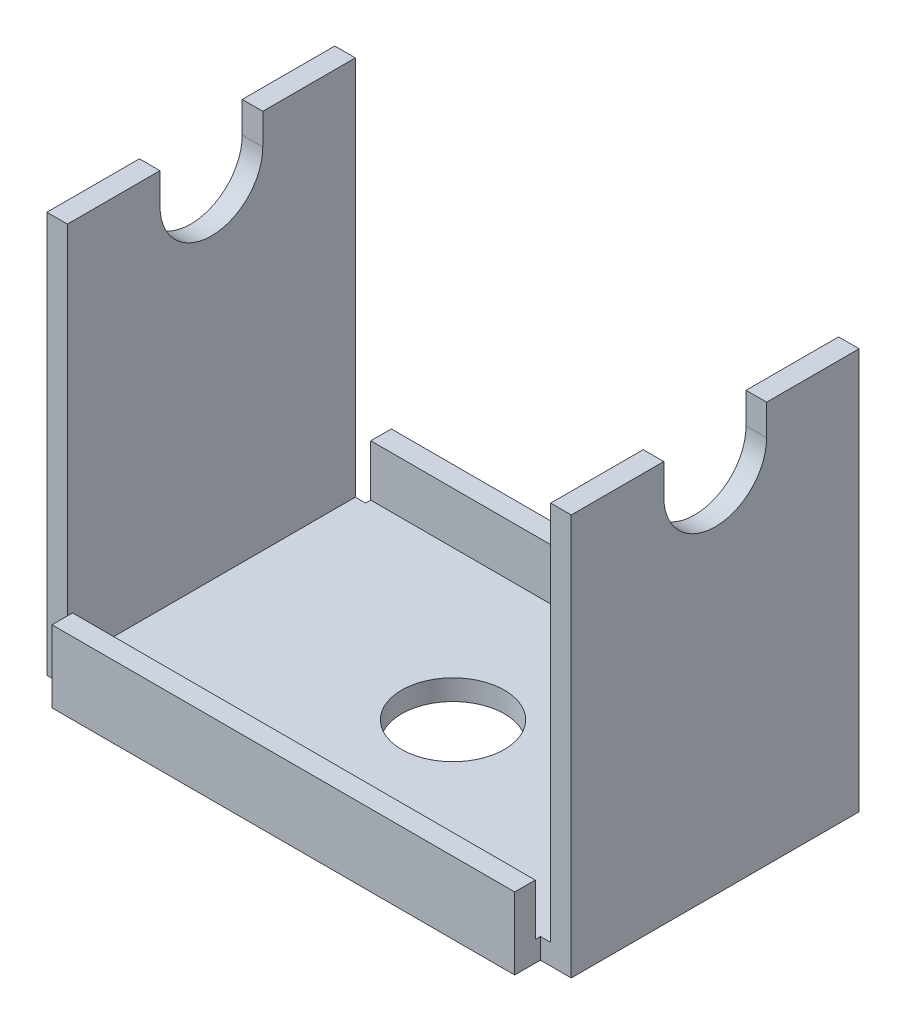
from build123d import *

# Parameters (mm, degrees)
BOSS_EXTRUDE1_DEPTH = 14
BOSS_EXTRUDE2_DEPTH = 22.5
CUT_EXTRUDE1_DEPTH  = 65.56972975
SKETCH4_R           = 5
CUT_EXTRUDE2_DEPTH  = 48.86961458


with BuildPart() as part:
    # Sketch1 → Boss-Extrude1 (new, symmetric)
    with BuildSketch(Plane.XY):
        Polygon((-25.5, 3), (-25.5, -36), (25.5, -36), (25.5, 3), (23.5, 3), (23.5, -34), (-23.5, -34), (-23.5, 3), align=None)
    extrude(amount=BOSS_EXTRUDE1_DEPTH, both=True)

    # Sketch2 → Boss-Extrude2 (add, symmetric)
    with BuildSketch(Plane(origin=(0, 0, 0), x_dir=(0, 0, -1), z_dir=(1, 0, 0))):
        Polygon((-14, -36), (-16.5, -36), (-16.5, -29), (-14.5, -29), (-14.5, -34), (-14, -34), align=None)
    boss_extrude2 = extrude(amount=BOSS_EXTRUDE2_DEPTH, both=True)

    # Mirror1: Boss-Extrude2 across plane
    add(boss_extrude2.mirror(Plane.XY))

    # Sketch3 → Cut-Extrude1 (cut, through all)
    with BuildSketch(Plane(origin=(25.5, 0, 0), x_dir=(0, 0, -1), z_dir=(1, 0, 0))):
        with BuildLine():
            Line((-5, 0), (-5, 3))
            Line((-5, 3), (5, 3))
            Line((5, 3), (5, 0))
            ThreePointArc((5, 0), (0, -5), (-5, 0))
        make_face()
    extrude(amount=-CUT_EXTRUDE1_DEPTH, mode=Mode.SUBTRACT)

    # Sketch4 → Cut-Extrude2 (cut, through all)
    with BuildSketch(Plane(origin=(0, -34, 0), x_dir=(1, 0, 0), z_dir=(0, 1, 0))):
        Circle(SKETCH4_R)
    extrude(amount=-CUT_EXTRUDE2_DEPTH, mode=Mode.SUBTRACT)


solid = part.part
